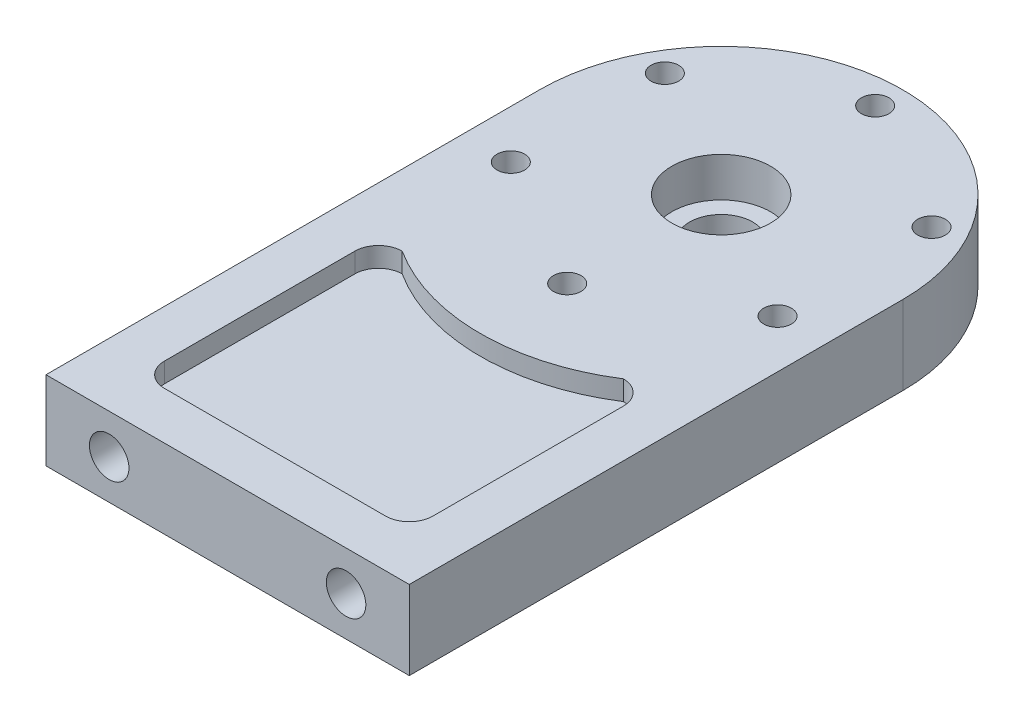
from build123d import *

# Parameters (mm, degrees)
BOSS_EXTRUDE1_DEPTH = 40
SKETCH5_R           = 25
CUT_EXTRUDE1_DEPTH  = 20
SKETCH6_R           = 16
CUT_EXTRUDE2_DEPTH  = 20
SKETCH7_R           = 7
CUT_EXTRUDE3_DEPTH  = 25
CIRPATTERN1_COUNT   = 6
SKETCH8_R           = 12
CUT_EXTRUDE4_DEPTH  = 15
CIRPATTERN2_COUNT   = 6
CUT_EXTRUDE5_DEPTH  = 10
SKETCH13_R          = 10
CUT_EXTRUDE10_DEPTH = 20


with BuildPart() as part:
    # Sketch3 → Boss-Extrude1 (new body)
    with BuildSketch(Plane(origin=(0, 0, 0), x_dir=(1, 0, 0), z_dir=(0, 1, 0))):
        with BuildLine():
            Line((0, 0), (184, 0))
            Line((184, 0), (184, 250))
            ThreePointArc((184, 250), (92, 342), (0, 250))
            Line((0, 250), (0, 0))
        make_face()
    extrude(amount=BOSS_EXTRUDE1_DEPTH)

    # Sketch5 → Cut-Extrude1 (cut)
    with BuildSketch(Plane(origin=(0, 40, 0), x_dir=(1, 0, 0), z_dir=(0, 1, 0))):
        with Locations((92, 250)):
            Circle(SKETCH5_R)
    extrude(amount=-CUT_EXTRUDE1_DEPTH, mode=Mode.SUBTRACT)

    # Sketch6 → Cut-Extrude2 (cut)
    with BuildSketch(Plane.XZ):
        with Locations((92, -250)):
            Circle(SKETCH6_R)
    extrude(amount=-CUT_EXTRUDE2_DEPTH, mode=Mode.SUBTRACT)

    # Sketch7 → Cut-Extrude3 (cut)
    with BuildSketch(Plane(origin=(0, 40, 0), x_dir=(1, 0, 0), z_dir=(0, 1, 0))):
        with Locations((92, 328)):
            Circle(SKETCH7_R)
    cut_extrude3 = extrude(amount=-CUT_EXTRUDE3_DEPTH, mode=Mode.SUBTRACT)

    # CirPattern1: Cut-Extrude3 ×6 about axis
    cirpattern1_axis = Axis((92, 40, -250), (0, 1, 0))
    for i in range(1, CIRPATTERN1_COUNT):
        add(cut_extrude3.rotate(cirpattern1_axis, i * 360 / CIRPATTERN1_COUNT), mode=Mode.SUBTRACT)

    # Sketch8 → Cut-Extrude4 (cut)
    with BuildSketch(Plane.XZ):
        with Locations((92, -328)):
            Circle(SKETCH8_R)
    cut_extrude4 = extrude(amount=-CUT_EXTRUDE4_DEPTH, mode=Mode.SUBTRACT)

    # CirPattern2: Cut-Extrude4 ×6 about axis
    cirpattern2_axis = Axis((92, 0, -250), (0, 1, 0))
    for i in range(1, CIRPATTERN2_COUNT):
        add(cut_extrude4.rotate(cirpattern2_axis, i * 360 / CIRPATTERN2_COUNT), mode=Mode.SUBTRACT)

    # Sketch9 → Cut-Extrude5 (cut)
    with BuildSketch(Plane(origin=(0, 40, 0), x_dir=(1, 0, 0), z_dir=(0, 1, 0))):
        with BuildLine():
            Line((36, 24), (148, 24))
            ThreePointArc((148, 24), (156.485281374, 27.514718626), (160, 36))
            Line((160, 36), (160, 132.420765027))
            ThreePointArc((160, 132.420765027), (156.485281374, 140.906046402), (148, 144.420765027))
            ThreePointArc((148, 144.420765027), (92, 128.056374228), (36, 144.420765027))
            ThreePointArc((36, 144.420765027), (27.514718626, 140.906046402), (24, 132.420765027))
            Line((24, 132.420765027), (24, 36))
            ThreePointArc((24, 36), (27.514718626, 27.514718626), (36, 24))
        make_face()
    cut_extrude5 = extrude(amount=-CUT_EXTRUDE5_DEPTH, mode=Mode.SUBTRACT)

    # Mirror1: Cut-Extrude5 across plane
    add(cut_extrude5.mirror(Plane.ZX.offset(20)), mode=Mode.SUBTRACT)

    # Sketch13 → Cut-Extrude10 (cut)
    with BuildSketch(Plane.XY):
        with Locations((32, 20)):
            Circle(SKETCH13_R)
        with Locations((152, 20)):
            Circle(SKETCH13_R)
    extrude(amount=-CUT_EXTRUDE10_DEPTH, mode=Mode.SUBTRACT)


solid = part.part
